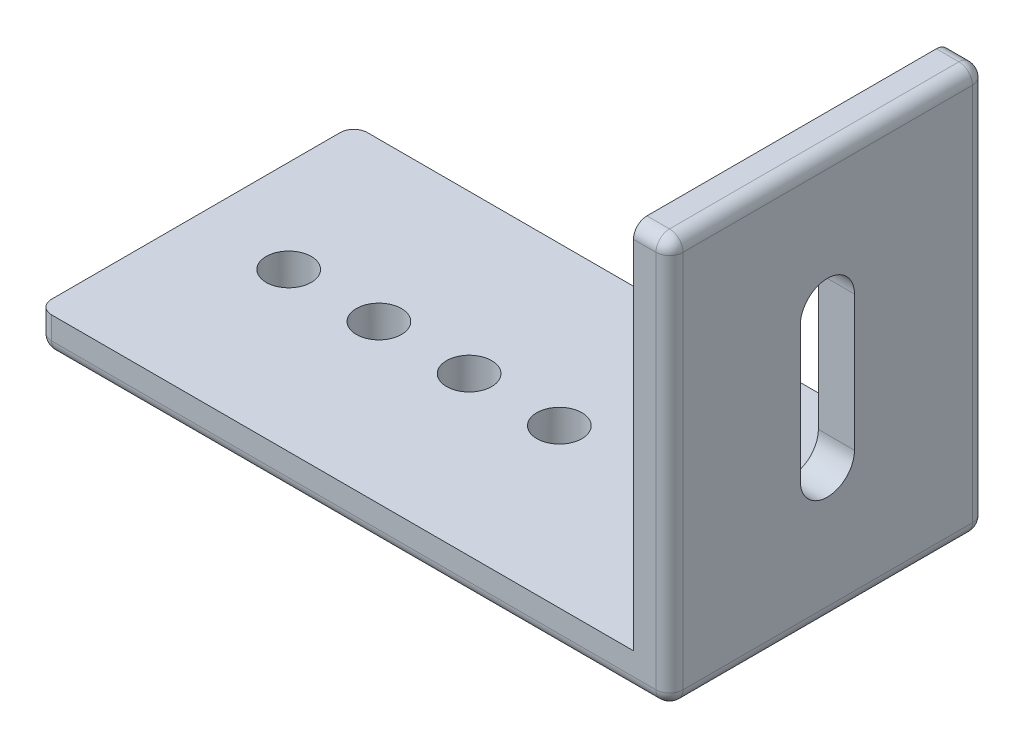
from build123d import *

# Parameters (mm, degrees)
SKETCH1_W               = 140
SKETCH1_H               = 70
BASE_EXTRUDE_DEPTH      = 8
SKETCH2_W               = 70.158062676
SKETCH2_H               = 90
VERTICAL_FLANGE_DEPTH   = 8
ADUJUSTMENT_SLOT_DEPTH  = 171.106112092
HOLE_PATTERN_DEPTH      = 114.402334064
HOLE_PATTERN_DEPTH_BACK = 114.402334064
SKETCH6_R               = 5
FILLET1_R               = 3
FILLET2_R               = 3
FILLET3_R               = 3


with BuildPart() as part:
    # Sketch1 → Base Extrude (new body)
    with BuildSketch(Plane(origin=(0, 0, 0), x_dir=(1, 0, 0), z_dir=(0, 1, 0))):
        Rectangle(SKETCH1_W, SKETCH1_H)
    extrude(amount=BASE_EXTRUDE_DEPTH)

    # Sketch2 → vertical flange (add)
    with BuildSketch(Plane(origin=(70, 0, 0), x_dir=(0, 0, -1), z_dir=(1, 0, 0))):
        with Locations((0.079031338, 45)):
            Rectangle(SKETCH2_W, SKETCH2_H)
    extrude(amount=-VERTICAL_FLANGE_DEPTH)

    # Sketch3 → adujustment slot (cut, through all)
    with BuildSketch(Plane(origin=(70, 0, 0), x_dir=(0, 0, -1), z_dir=(1, 0, 0))):
        with BuildLine():
            Line((6, 60), (6, 30))
            ThreePointArc((6, 30), (0, 24), (-6, 30))
            Line((-6, 30), (-6, 60))
            ThreePointArc((-6, 60), (0, 66), (6, 60))
        make_face()
    extrude(amount=-ADUJUSTMENT_SLOT_DEPTH, mode=Mode.SUBTRACT)

    # Sketch6 → Hole_Pattern (cut, two sides: drawn at the far end of the back side and taken through both)
    with BuildSketch(Plane(origin=(0, 8, 0), x_dir=(1, 0, 0), z_dir=(0, 1, 0)).offset(-HOLE_PATTERN_DEPTH_BACK)):
        with Locations(Location((-49.427742691, 0, 0), (0, 0, 270))):
            Circle(SKETCH6_R)
        with Locations(Location((-29.427742691, 0, 0), (0, 0, 270))):
            Circle(SKETCH6_R)
        with Locations(Location((-9.427742691, 0, 0), (0, 0, 270))):
            Circle(SKETCH6_R)
        with Locations(Location((10.572257309, 0, 0), (0, 0, 270))):
            Circle(SKETCH6_R)
    extrude(amount=HOLE_PATTERN_DEPTH + HOLE_PATTERN_DEPTH_BACK, mode=Mode.SUBTRACT)

    # Fillet1
    fillet1_edges = [part.edges().sort_by_distance(p)[0] for p in [
        (-4, 0, -35),
        (0, 0, 35),
        (-70, 0, 0),
        (70, 0, -0.079031338),
    ]]
    fillet(fillet1_edges, radius=FILLET1_R)

    # Fillet2
    # the kernel refuses this fillet: 3 mm, written as the material it takes off along each edge
    with BuildSketch(Plane(origin=(-67, 3, 32), x_dir=(-1, 0, 0), z_dir=(0, 0, 1))) as fillet2_piece_1_section:
        Polygon((0, 0), (FILLET2_R, 0), (FILLET2_R, FILLET2_R), (0, FILLET2_R), align=None)
    fillet2_piece_1 = extrude(amount=FILLET2_R, mode=Mode.PRIVATE)
    fillet2_piece_1 = fillet2_piece_1 - Plane(origin=(-67, 3, 32), x_dir=(0.7071067811865475, 0.7071067811865475, 0), z_dir=(0, 0, 1)) * Sphere(FILLET2_R, mode=Mode.PRIVATE)
    add(fillet2_piece_1, mode=Mode.SUBTRACT)
    with BuildSketch(Plane(origin=(67, 3, 32), x_dir=(1, 0, 0), z_dir=(0, 0, 1))) as fillet2_piece_2_section:
        Polygon((0, 0), (FILLET2_R, 0), (FILLET2_R, -FILLET2_R), (0, -FILLET2_R), align=None)
    fillet2_piece_2 = extrude(amount=FILLET2_R, mode=Mode.PRIVATE)
    fillet2_piece_2 = fillet2_piece_2 - Plane(origin=(67, 3, 32), x_dir=(-0.7071067811865475, 0.7071067811865475, 0), z_dir=(0, 0, 1)) * Sphere(FILLET2_R, mode=Mode.PRIVATE)
    add(fillet2_piece_2, mode=Mode.SUBTRACT)
    with BuildSketch(Plane(origin=(67, 87, -32.158062676), x_dir=(0, 0, -1), z_dir=(0, 1, 0))) as fillet2_piece_3_section:
        Polygon((0, 0), (FILLET2_R, 0), (FILLET2_R, -FILLET2_R), (0, -FILLET2_R), align=None)
    fillet2_piece_3 = extrude(amount=FILLET2_R, mode=Mode.PRIVATE)
    fillet2_piece_3 = fillet2_piece_3 - Plane(origin=(67, 87, -32.158062676), x_dir=(-0.7071067811865475, 0, 0.7071067811865475), z_dir=(0, 1, 0)) * Sphere(FILLET2_R, mode=Mode.PRIVATE)
    add(fillet2_piece_3, mode=Mode.SUBTRACT)
    with BuildSketch(Plane(origin=(67, 87, 32), x_dir=(0, 1, 0), z_dir=(0, 0, 1))) as fillet2_piece_4_section:
        Polygon((0, 0), (FILLET2_R, 0), (FILLET2_R, -FILLET2_R), (0, -FILLET2_R), align=None)
    fillet2_piece_4 = extrude(amount=FILLET2_R, mode=Mode.PRIVATE)
    fillet2_piece_4 = fillet2_piece_4 - Plane(origin=(67, 87, 32), x_dir=(-0.7071067811865475, -0.7071067811865475, 0), z_dir=(0, 0, 1)) * Sphere(FILLET2_R, mode=Mode.PRIVATE)
    add(fillet2_piece_4, mode=Mode.SUBTRACT)
    with BuildSketch(Plane(origin=(67, 0, -35.158062676), x_dir=(0, 1, 0), z_dir=(-1, 0, 0)), Plane(origin=(67, 90, 35), x_dir=(0, -1, 0), z_dir=(-1, 0, 0)), Plane(origin=(67, 90, -35.158062676), x_dir=(0, 0, 1), z_dir=(-1, 0, 0))) as fillet2_piece_5:
        with BuildLine():
            CenterArc((FILLET2_R, -FILLET2_R), FILLET2_R, 90, 90)
            Line((0, -FILLET2_R), (0, 0))
            Line((0, 0), (FILLET2_R, 0))
        make_face()
    extrude(amount=12.5, mode=Mode.SUBTRACT)
    with BuildSketch(Plane(origin=(70, 90, -32.158062676), x_dir=(-1, 0, 0), z_dir=(0, 0, 1))) as fillet2_piece_6:
        with BuildLine():
            CenterArc((FILLET2_R, FILLET2_R), FILLET2_R, 180, 90)
            Line((0, FILLET2_R), (0, 0))
            Line((0, 0), (FILLET2_R, 0))
        make_face()
    extrude(amount=64.158062676, mode=Mode.SUBTRACT)
    with BuildSketch(Plane(origin=(70, 3, -35.158062676), x_dir=(-1, 0, 0), z_dir=(0, 1, 0))) as fillet2_piece_7:
        with BuildLine():
            CenterArc((FILLET2_R, FILLET2_R), FILLET2_R, 180, 90)
            Line((0, FILLET2_R), (0, 0))
            Line((0, 0), (FILLET2_R, 0))
        make_face()
    extrude(amount=84, mode=Mode.SUBTRACT)
    with BuildSketch(Plane(origin=(67, 3, -35.158062676), x_dir=(0, -1, 0), z_dir=(-1, 0, 0))) as fillet2_piece_8:
        with BuildLine():
            CenterArc((3 - FILLET2_R, FILLET2_R), FILLET2_R, 270, 90)
            Line((3, FILLET2_R), (3, 0))
            Line((3, 0), (3 - FILLET2_R, 0))
        make_face()
    revolve(axis=Axis((67, 3, -35.158062676), (0, 0, 1)), revolution_arc=90, mode=Mode.SUBTRACT)
    with BuildSketch(Plane(origin=(70, 3, 35), x_dir=(-1, 0, 0), z_dir=(0, 1, 0))) as fillet2_piece_9:
        with BuildLine():
            CenterArc((FILLET2_R, -FILLET2_R), FILLET2_R, 90, 90)
            Line((0, -FILLET2_R), (0, 0))
            Line((0, 0), (FILLET2_R, 0))
        make_face()
    extrude(amount=84, mode=Mode.SUBTRACT)
    with BuildSketch(Plane(origin=(-70, 3, 35), x_dir=(1, 0, 0), z_dir=(0, 1, 0))) as fillet2_piece_10:
        with BuildLine():
            CenterArc((FILLET2_R, FILLET2_R), FILLET2_R, 180, 90)
            Line((0, FILLET2_R), (0, 0))
            Line((0, 0), (FILLET2_R, 0))
        make_face()
    extrude(amount=12.5, mode=Mode.SUBTRACT)

    # Fillet3
    # the kernel refuses this fillet: 3 mm, written as the material it takes off along each edge
    with BuildSketch(Plane(origin=(-67, 3, -32), x_dir=(-1, 0, 0), z_dir=(0, 0, -1))) as fillet3_piece_1_section:
        Polygon((0, 0), (FILLET3_R, 0), (FILLET3_R, -FILLET3_R), (0, -FILLET3_R), align=None)
    fillet3_piece_1 = extrude(amount=FILLET3_R, mode=Mode.PRIVATE)
    fillet3_piece_1 = fillet3_piece_1 - Plane(origin=(-67, 3, -32), x_dir=(0.7071067811865475, 0.7071067811865475, 0), z_dir=(0, 0, -1)) * Sphere(FILLET3_R, mode=Mode.PRIVATE)
    add(fillet3_piece_1, mode=Mode.SUBTRACT)
    with BuildSketch(Plane(origin=(-70, 3, -35), x_dir=(1, 0, 0), z_dir=(0, 1, 0))) as fillet3_piece_2:
        with BuildLine():
            CenterArc((FILLET3_R, -FILLET3_R), FILLET3_R, 90, 90)
            Line((0, -FILLET3_R), (0, 0))
            Line((0, 0), (FILLET3_R, 0))
        make_face()
    extrude(amount=12.5, mode=Mode.SUBTRACT)


solid = part.part
